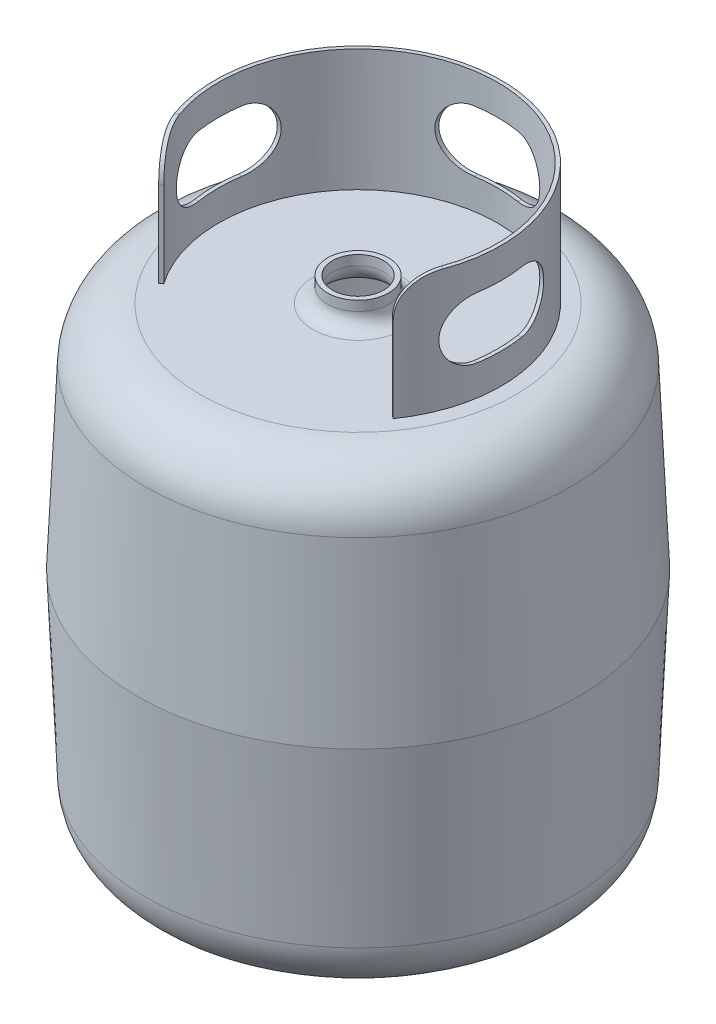
from build123d import *

# Parameters (mm, degrees)
BOSS_EXTRUDE1_DEPTH = 100
FILLET1_R           = 30
CUT_EXTRUDE1_DEPTH  = 473.58953682
CIRPATTERN1_COUNT   = 4


# Read off the part's stored shape, not the designer's step: Shell2
with BuildPart() as part:
    # Sketch1 → Revolve2 (revolve)
    with BuildSketch(Plane(origin=(0, 0, 0), x_dir=(0, 0, -1), z_dir=(1, 0, 0))):
        with BuildLine():
            Line((-25, -8), (-25, 0))
            Line((-25, 0), (0, 0))
            Line((0, 0), (0, -397.5))
            Line((0, -397.5), (-129.421871599, -397.5))
            ThreePointArc((-129.421871599, -397.5), (-160.539959109, -385.006378293), (-174.37904157, -354.462872431))
            Line((-174.37904157, -354.462872431), (-180.741002974, -208.75))
            Line((-180.741002974, -208.75), (-174.37904157, -63.037127569))
            ThreePointArc((-174.37904157, -63.037127569), (-160.539959109, -32.493621707), (-129.421871599, -20))
            Line((-129.421871599, -20), (-37, -20))
            ThreePointArc((-37, -20), (-28.514718626, -16.485281374), (-25, -8))
        make_face()
    revolve(axis=Axis((0, 0, 0), (0, -1, 0)))

    # Shell2 outline → Shell2 (revolve, cut)
    with BuildSketch(Plane.XY):
        with BuildLine():
            Line((0, -393.5), (129.421871599, -393.5))
            ThreePointArc((129.421871599, -393.5), (157.773906886, -382.116922444), (170.382848683, -354.288394882))
            Line((170.382848683, -354.288394882), (176.737192233, -208.75))
            Line((176.737192233, -208.75), (170.382848683, -63.211605118))
            ThreePointArc((170.382848683, -63.211605118), (157.773906886, -35.383077556), (129.421871599, -24))
            Line((129.421871599, -24), (37, -24))
            ThreePointArc((37, -24), (25.686291501, -19.313708499), (21, -8))
            Line((21, -8), (21, 0))
            Line((21, 0), (0, 0))
            Line((0, 0), (0, -393.5))
        make_face()
    revolve(axis=Axis((0, 0, 0), (0, 1, 0)), mode=Mode.SUBTRACT)

    # Sketch2 → Boss-Extrude1 (add)
    with BuildSketch(Plane(origin=(0, -20, 0), x_dir=(1, 0, 0), z_dir=(0, 1, 0))):
        with BuildLine():
            ThreePointArc((-93.728910031, -65.629689352), (0, 114.421871599), (93.728910031, -65.629689352))
            Line((93.728910031, -65.629689352), (96.186366164, -67.350418661))
            ThreePointArc((96.186366164, -67.350418661), (0, 117.421871599), (-96.186366164, -67.350418661))
            Line((-96.186366164, -67.350418661), (-93.728910031, -65.629689352))
        make_face()
    extrude(amount=BOSS_EXTRUDE1_DEPTH)

    # Fillet1
    # the kernel refuses this fillet: 30 mm, written as the material it takes off along each edge
    with BuildSketch(Plane(origin=(-157.622769486, 80, 110.368651387), x_dir=(0, -1, 0), z_dir=(0.8191520442889927, 0, -0.573576436351045))) as fillet1_piece_1_section:
        with BuildLine():
            CenterArc((FILLET1_R, FILLET1_R), FILLET1_R, 180, 90)
            Line((0, FILLET1_R), (-FILLET1_R * 0.02, FILLET1_R))
            Line((-FILLET1_R * 0.02, FILLET1_R), (-FILLET1_R * 0.02, -FILLET1_R * 0.02))
            Line((-FILLET1_R * 0.02, -FILLET1_R * 0.02), (FILLET1_R, -FILLET1_R * 0.02))
            Line((FILLET1_R, -FILLET1_R * 0.02), (FILLET1_R, 0))
        make_face()
    fillet1_piece_1 = extrude(amount=153, mode=Mode.PRIVATE)
    fillet1_piece_1 = fillet1_piece_1 & Plane(origin=(0, 73.224697154, 0), x_dir=(0.8191520442889935, 0, 0.5735764363510439), z_dir=(0, -1, 0)) * Cylinder(117.421871599, 426, mode=Mode.PRIVATE)
    fillet1_piece_1 = fillet1_piece_1 - Plane(origin=(0, 73.224697154, 0), x_dir=(-0.8191520442889932, 0, 0.5735764363510442), z_dir=(0, -1, 0)) * Cylinder(114.421871599, 426, mode=Mode.PRIVATE)
    add(fillet1_piece_1, mode=Mode.SUBTRACT)
    with BuildSketch(Plane(origin=(32.29250671, 80, 22.611456626), x_dir=(0, -1, 0), z_dir=(0.8191520442889919, 0, 0.5735764363510459))) as fillet1_piece_2_section:
        with BuildLine():
            CenterArc((FILLET1_R, FILLET1_R), FILLET1_R, 180, 90)
            Line((0, FILLET1_R), (-FILLET1_R * 0.02, FILLET1_R))
            Line((-FILLET1_R * 0.02, FILLET1_R), (-FILLET1_R * 0.02, -FILLET1_R * 0.02))
            Line((-FILLET1_R * 0.02, -FILLET1_R * 0.02), (FILLET1_R, -FILLET1_R * 0.02))
            Line((FILLET1_R, -FILLET1_R * 0.02), (FILLET1_R, 0))
        make_face()
    fillet1_piece_2 = extrude(amount=153, mode=Mode.PRIVATE)
    fillet1_piece_2 = fillet1_piece_2 & Plane(origin=(0, 73.224723682, 0), x_dir=(0.8191520442889935, 0, 0.5735764363510439), z_dir=(0, -1, 0)) * Cylinder(117.421871599, 427, mode=Mode.PRIVATE)
    fillet1_piece_2 = fillet1_piece_2 - Plane(origin=(0, 73.224723682, 0), x_dir=(-0.8191520442889932, 0, 0.5735764363510442), z_dir=(0, -1, 0)) * Cylinder(114.421871599, 427, mode=Mode.PRIVATE)
    add(fillet1_piece_2, mode=Mode.SUBTRACT)

    # Sketch4 → Cut-Extrude1 (cut, symmetric)
    with BuildSketch(Plane(origin=(0, 0, 0), x_dir=(0, 0, -1), z_dir=(1, 0, 0))):
        with BuildLine():
            Line((-18, 5), (18, 5))
            ThreePointArc((18, 5), (43, 30), (18, 55))
            Line((18, 55), (-18, 55))
            ThreePointArc((-18, 55), (-43, 30), (-18, 5))
        make_face()
    cut_extrude1 = extrude(amount=CUT_EXTRUDE1_DEPTH, both=True, mode=Mode.SUBTRACT)

    # CirPattern1: Cut-Extrude1 ×4 about axis
    cirpattern1_axis = Axis((0, 80, 0), (0, 1, 0))
    for i in range(1, CIRPATTERN1_COUNT):
        add(cut_extrude1.rotate(cirpattern1_axis, i * 360 / CIRPATTERN1_COUNT), mode=Mode.SUBTRACT)


solid = part.part
